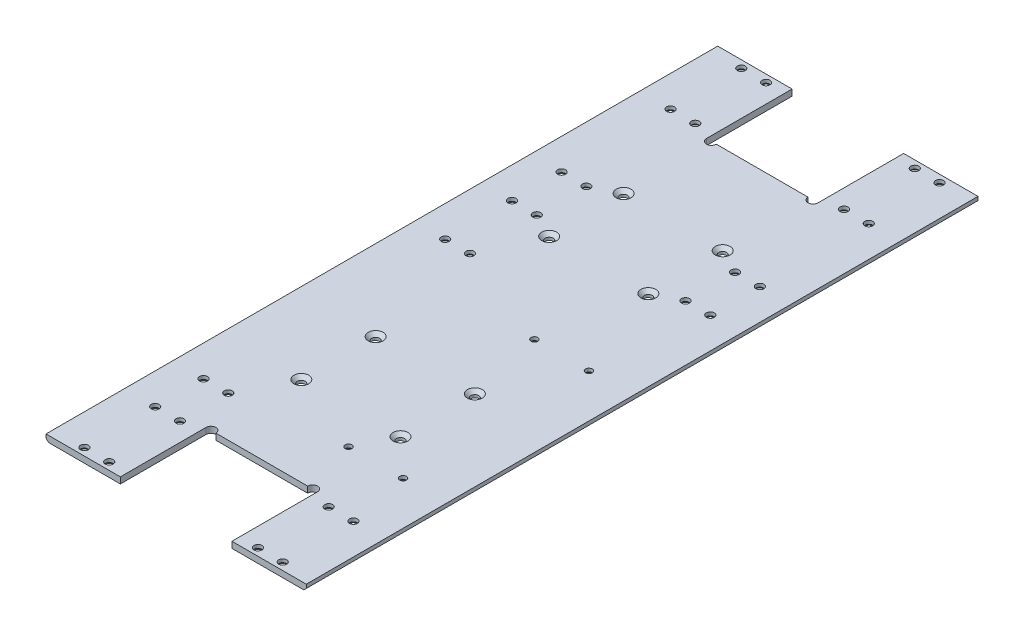
from build123d import *

# Parameters (mm, degrees)
SKETCH_1_W          = 105
SKETCH_1_H          = 271
EXTRUDE_1_DEPTH     = 2.5
SKETCH_2_R          = 1.35
SKETCH_2_R_2        = 1.6
CUT_EXTRUDE_1_DEPTH = 10
CHAMFER_4_SIZE      = 1.4
CHAMFER_5_SIZE      = 1
CUT_EXTRUDE_2_DEPTH = 10
SKETCH_6_R          = 1.6
CUT_EXTRUDE_3_DEPTH = 10
SKETCH_7_R          = 1.6
CUT_EXTRUDE_4_DEPTH = 10
SKETCH_8_R          = 1.6
CUT_EXTRUDE_5_DEPTH = 10
SKETCH_9_R          = 2
CUT_EXTRUDE_6_DEPTH = 10
CHAMFER_3_SIZE      = 1.15


with BuildPart() as part:
    # 草图1 → 凸台-拉伸1 (new body)
    with BuildSketch(Plane(origin=(0, 0, 0), x_dir=(1, 0, 0), z_dir=(0, 1, 0))):
        Rectangle(SKETCH_1_W, SKETCH_1_H)
    extrude(amount=EXTRUDE_1_DEPTH)

    # 草图2 → 切除-拉伸1 (cut)
    with BuildSketch(Plane(origin=(0, 2.5, 0), x_dir=(1, 0, 0), z_dir=(0, 1, 0))):
        with Locations((35, -3.95)):
            Circle(SKETCH_2_R)
        with Locations((13.000000181, -3.95)):
            Circle(SKETCH_2_R)
        with Locations((35, -78.95)):
            Circle(SKETCH_2_R)
        with Locations((13.000000181, -78.95)):
            Circle(SKETCH_2_R)
        with Locations((20, -35)):
            Circle(SKETCH_2_R_2)
        with Locations((-20, -35)):
            Circle(SKETCH_2_R_2)
        with Locations((20, -65)):
            Circle(SKETCH_2_R_2)
        with Locations((-20, -65)):
            Circle(SKETCH_2_R_2)
        with Locations((-20, 35)):
            Circle(SKETCH_2_R_2)
        with Locations((20, 35)):
            Circle(SKETCH_2_R_2)
        with Locations((-20, 65)):
            Circle(SKETCH_2_R_2)
        with Locations((20, 65)):
            Circle(SKETCH_2_R_2)
    extrude(amount=-CUT_EXTRUDE_1_DEPTH, mode=Mode.SUBTRACT)

    # 倒角4
    chamfer_4_edges = [part.edges().sort_by_distance(p)[0] for p in [
        (-21.6, 2.5, 65),
        (-21.6, 2.5, 35),
        (18.4, 2.5, 65),
        (18.4, 2.5, 35),
        (-21.6, 2.5, -35),
        (-21.6, 2.5, -65),
        (18.4, 2.5, -35),
        (18.4, 2.5, -65),
    ]]
    chamfer(chamfer_4_edges, length=CHAMFER_4_SIZE)

    # 倒角5
    chamfer_5_edges = [part.edges().sort_by_distance(p)[0] for p in [
        (52.5, 0, 0),
        (-52.5, 0, 0),
    ]]
    chamfer(chamfer_5_edges, length=CHAMFER_5_SIZE)

    # 草图4 → 切除-拉伸2 (cut)
    with BuildSketch(Plane.XZ):
        Polygon((0, 100.95), (22.5, 100.95), (22.5, 135.5), (-22.5, 135.5), (-22.5, 100.95), align=None)
        Polygon((-22.5, -100.95), (0, -100.95), (22.5, -100.95), (22.5, -135.5), (-22.5, -135.5), align=None)
    extrude(amount=-CUT_EXTRUDE_2_DEPTH, mode=Mode.SUBTRACT)

    # 草图6 → 切除-拉伸3 (cut)
    with BuildSketch(Plane.XZ):
        with Locations((-40, 132.5)):
            Circle(SKETCH_6_R)
        with Locations((-30, 132.5)):
            Circle(SKETCH_6_R)
        with Locations((-30, 103.95)):
            Circle(SKETCH_6_R)
        with Locations((-40, 103.95)):
            Circle(SKETCH_6_R)
        with Locations((40, 103.95)):
            Circle(SKETCH_6_R)
        with Locations((30, 103.95)):
            Circle(SKETCH_6_R)
        with Locations((30, 132.5)):
            Circle(SKETCH_6_R)
        with Locations((40, 132.5)):
            Circle(SKETCH_6_R)
        with Locations((40, -132.5)):
            Circle(SKETCH_6_R)
        with Locations((30, -132.5)):
            Circle(SKETCH_6_R)
        with Locations((30, -103.95)):
            Circle(SKETCH_6_R)
        with Locations((40, -103.95)):
            Circle(SKETCH_6_R)
        with Locations((-40, -103.95)):
            Circle(SKETCH_6_R)
        with Locations((-30, -103.95)):
            Circle(SKETCH_6_R)
        with Locations((-30, -132.5)):
            Circle(SKETCH_6_R)
        with Locations((-40, -132.5)):
            Circle(SKETCH_6_R)
    extrude(amount=-CUT_EXTRUDE_3_DEPTH, mode=Mode.SUBTRACT)

    # 草图7 → 切除-拉伸4 (cut)
    with BuildSketch(Plane(origin=(0, 2.5, 0), x_dir=(1, 0, 0), z_dir=(0, 1, 0))):
        with Locations((-40, 60)):
            Circle(SKETCH_7_R)
        with Locations((-30, 60)):
            Circle(SKETCH_7_R)
        with Locations((30, 60)):
            Circle(SKETCH_7_R)
        with Locations((40, 60)):
            Circle(SKETCH_7_R)
        with Locations((-40, 40)):
            Circle(SKETCH_7_R)
        with Locations((-30, 40)):
            Circle(SKETCH_7_R)
        with Locations((30, 40)):
            Circle(SKETCH_7_R)
        with Locations((40, 40)):
            Circle(SKETCH_7_R)
    extrude(amount=-CUT_EXTRUDE_4_DEPTH, mode=Mode.SUBTRACT)

    # 草图8 → 切除-拉伸5 (cut)
    with BuildSketch(Plane.XZ):
        with Locations((-40, 84.45)):
            Circle(SKETCH_8_R)
        with Locations((-30, 84.45)):
            Circle(SKETCH_8_R)
        with Locations((-40, -13.05)):
            Circle(SKETCH_8_R)
        with Locations((-30, -13.05)):
            Circle(SKETCH_8_R)
    extrude(amount=-CUT_EXTRUDE_5_DEPTH, mode=Mode.SUBTRACT)

    # 草图9 → 切除-拉伸6 (cut)
    with BuildSketch(Plane.XZ):
        with Locations((20.5, 100.95)):
            Circle(SKETCH_9_R)
        with Locations((-20.5, 100.95)):
            Circle(SKETCH_9_R)
        with Locations((-20.5, -100.95)):
            Circle(SKETCH_9_R)
        with Locations((20.5, -100.95)):
            Circle(SKETCH_9_R)
    extrude(amount=-CUT_EXTRUDE_6_DEPTH, mode=Mode.SUBTRACT)

    # 倒角3
    chamfer_3_edges = [part.edges().sort_by_distance(p)[0] for p in [
        (11.650000181, 0, 3.95),
        (33.65, 0, 3.95),
        (33.65, 0, 78.95),
        (11.650000181, 0, 78.95),
        (38.4, 0, 103.95),
        (38.4, 0, 132.5),
        (28.4, 0, 103.95),
        (28.4, 0, 132.5),
        (-31.6, 0, 103.95),
        (-31.6, 0, 132.5),
        (-41.6, 0, 103.95),
        (-41.6, 0, 132.5),
        (38.4, 0, -103.95),
        (38.4, 0, -132.5),
        (28.4, 0, -132.5),
        (28.4, 0, -103.95),
        (-31.6, 0, -132.5),
        (-31.6, 0, -103.95),
        (-41.6, 0, -132.5),
        (-41.6, 0, -103.95),
        (38.4, 0, -60),
        (28.4, 0, -60),
        (-31.6, 0, -60),
        (-41.6, 0, -60),
        (-31.6, 0, -13.05),
        (-41.6, 0, -13.05),
        (-31.6, 0, 84.45),
        (-41.6, 0, 84.45),
        (-41.6, 0, -40),
        (-31.6, 0, -40),
        (28.4, 0, -40),
        (38.4, 0, -40),
    ]]
    chamfer(chamfer_3_edges, length=CHAMFER_3_SIZE)


solid = part.part
